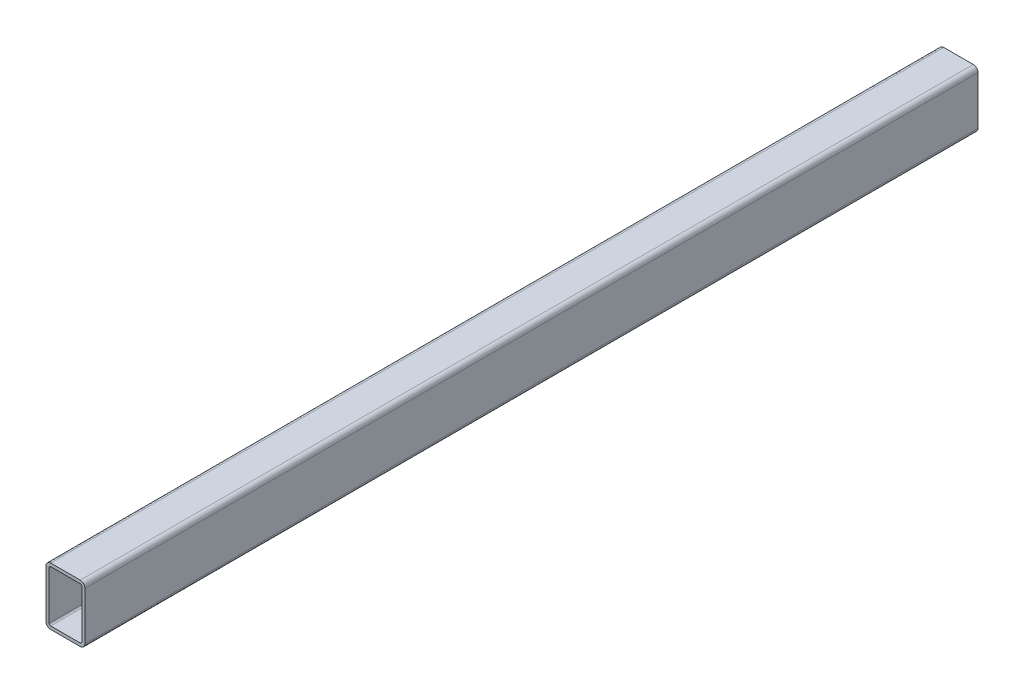
from build123d import *

# Parameters (mm, degrees)
EXTRUDE_THIN1_DEPTH = 287


with BuildPart() as part:
    # Sketch1 → Extrude-Thin1 (new, symmetric)
    with BuildSketch(Plane.XY):
        with BuildLine():
            Line((-9.5, 37), (9.5, 37))
            ThreePointArc((9.5, 37), (11.621320344, 36.121320344), (12.5, 34))
            Line((12.5, 34), (12.5, 3))
            ThreePointArc((12.5, 3), (11.621320344, 0.878679656), (9.5, 0))
            Line((9.5, 0), (-9.5, 0))
            ThreePointArc((-9.5, 0), (-11.621320344, 0.878679656), (-12.5, 3))
            Line((-12.5, 3), (-12.5, 34))
            ThreePointArc((-12.5, 34), (-11.621320344, 36.121320344), (-9.5, 37))
        make_face()
        with BuildLine():
            Line((-9.5, 35), (9.5, 35))
            ThreePointArc((9.5, 35), (10.207106781, 34.707106781), (10.5, 34))
            Line((10.5, 34), (10.5, 3))
            ThreePointArc((10.5, 3), (10.207106781, 2.292893219), (9.5, 2))
            Line((9.5, 2), (-9.5, 2))
            ThreePointArc((-9.5, 2), (-10.207106781, 2.292893219), (-10.5, 3))
            Line((-10.5, 3), (-10.5, 34))
            ThreePointArc((-10.5, 34), (-10.207106781, 34.707106781), (-9.5, 35))
        make_face(mode=Mode.SUBTRACT)
    extrude(amount=EXTRUDE_THIN1_DEPTH, both=True)


solid = part.part
